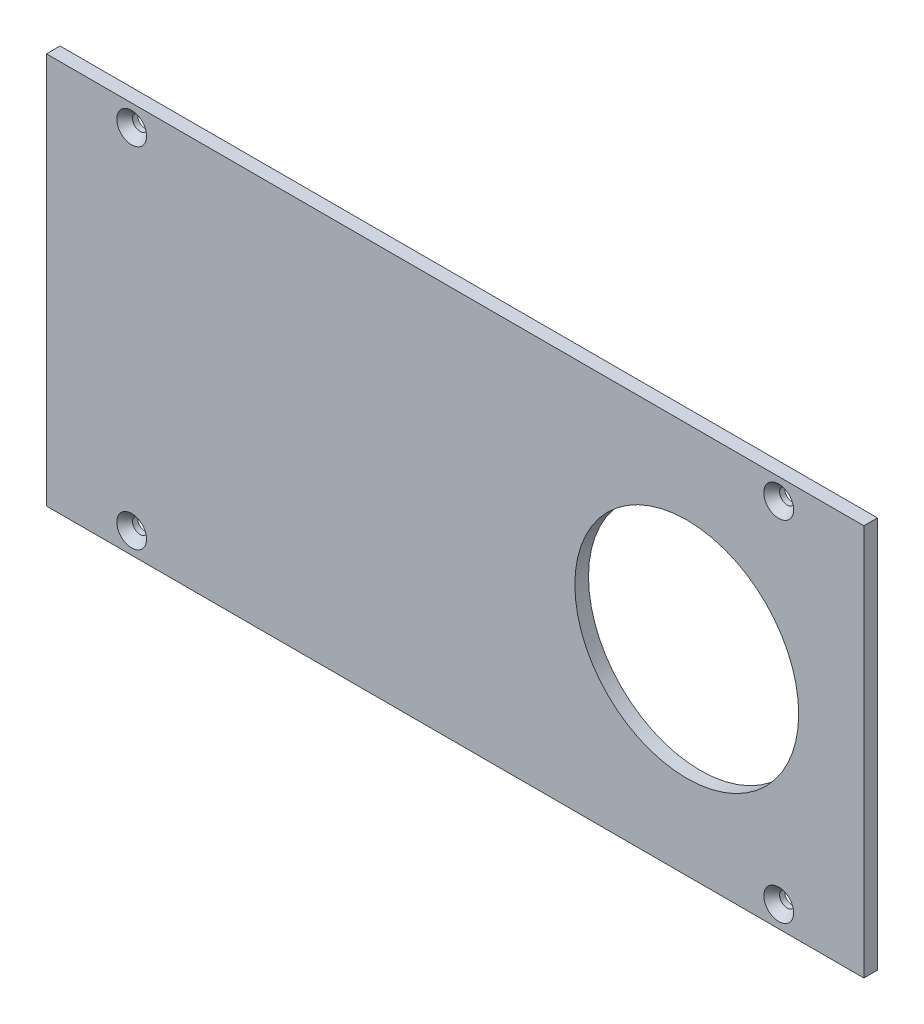
from build123d import *

# Parameters (mm, degrees)
SKETCH1_W                                     = 96
SKETCH1_H                                     = 46
BOSS_EXTRUDE1_DEPTH                           = 1.6002
SKETCH2_R                                     = 13.1445
CUT_EXTRUDE1_DEPTH                            = 107.463893598
CSK_FOR_0_FLAT_HEAD_SOCKET_CAP_SCREW1_A_COUNT = 2
CSK_FOR_0_FLAT_HEAD_SOCKET_CAP_SCREW1_A_PITCH = 41
CSK_FOR_0_FLAT_HEAD_SOCKET_CAP_SCRE_2_COUNT   = 2
CSK_FOR_0_FLAT_HEAD_SOCKET_CAP_SCRE_2_PITCH   = 86.353922899
CSK_FOR_0_FLAT_HEAD_SOCKET_CAP_SCRE_3_COUNT   = 2
CSK_FOR_0_FLAT_HEAD_SOCKET_CAP_SCRE_3_PITCH   = 76


with BuildPart() as part:
    # Sketch1 → Boss-Extrude1 (new body)
    with BuildSketch(Plane.XY):
        with Locations((48, 23)):
            Rectangle(SKETCH1_W, SKETCH1_H)
    extrude(amount=BOSS_EXTRUDE1_DEPTH)

    # Sketch2 → Cut-Extrude1 (cut, through all)
    with BuildSketch(Plane.XY.offset(1.6002)):
        with Locations((75.2, 23.05)):
            Circle(SKETCH2_R)
    extrude(amount=-CUT_EXTRUDE1_DEPTH, mode=Mode.SUBTRACT)

    # Sketch7 → CSK for #0 Flat Head Socket Cap Screw1 (revolve, cut)
    with BuildSketch(Plane(origin=(10, 43.5, 1.6002), x_dir=(0, -1, 0), z_dir=(1, 0, 0))):
        Polygon((0, 0), (0, 1.6002), (0.889, 1.6002), (0.889, 0.993458156), (1.7526, 0), align=None)
    csk_for_0_flat_head_socket_cap_screw1 = revolve(axis=Axis((10, 43.5, 7.9502), (0, 0, -1)), mode=Mode.SUBTRACT)

    # CSK for #0 Flat Head Socket Cap Screw1 a: CSK for #0 Flat Head Socket Cap Screw1 ×2
    with Locations(*[(0, -i * CSK_FOR_0_FLAT_HEAD_SOCKET_CAP_SCREW1_A_PITCH, 0) for i in range(1, CSK_FOR_0_FLAT_HEAD_SOCKET_CAP_SCREW1_A_COUNT)]):
        add(csk_for_0_flat_head_socket_cap_screw1, mode=Mode.SUBTRACT)

    # CSK for _0 Flat Head Socket Cap Scre 2: CSK for #0 Flat Head Socket Cap Screw1 ×2
    with Locations(*[Vector(0.8800989862281838, -0.47479024257046726, 0) * (i * CSK_FOR_0_FLAT_HEAD_SOCKET_CAP_SCRE_2_PITCH) for i in range(1, CSK_FOR_0_FLAT_HEAD_SOCKET_CAP_SCRE_2_COUNT)]):
        add(csk_for_0_flat_head_socket_cap_screw1, mode=Mode.SUBTRACT)

    # CSK for _0 Flat Head Socket Cap Scre 3: CSK for #0 Flat Head Socket Cap Screw1 ×2
    with Locations(*[(i * CSK_FOR_0_FLAT_HEAD_SOCKET_CAP_SCRE_3_PITCH, 0, 0) for i in range(1, CSK_FOR_0_FLAT_HEAD_SOCKET_CAP_SCRE_3_COUNT)]):
        add(csk_for_0_flat_head_socket_cap_screw1, mode=Mode.SUBTRACT)


solid = part.part
